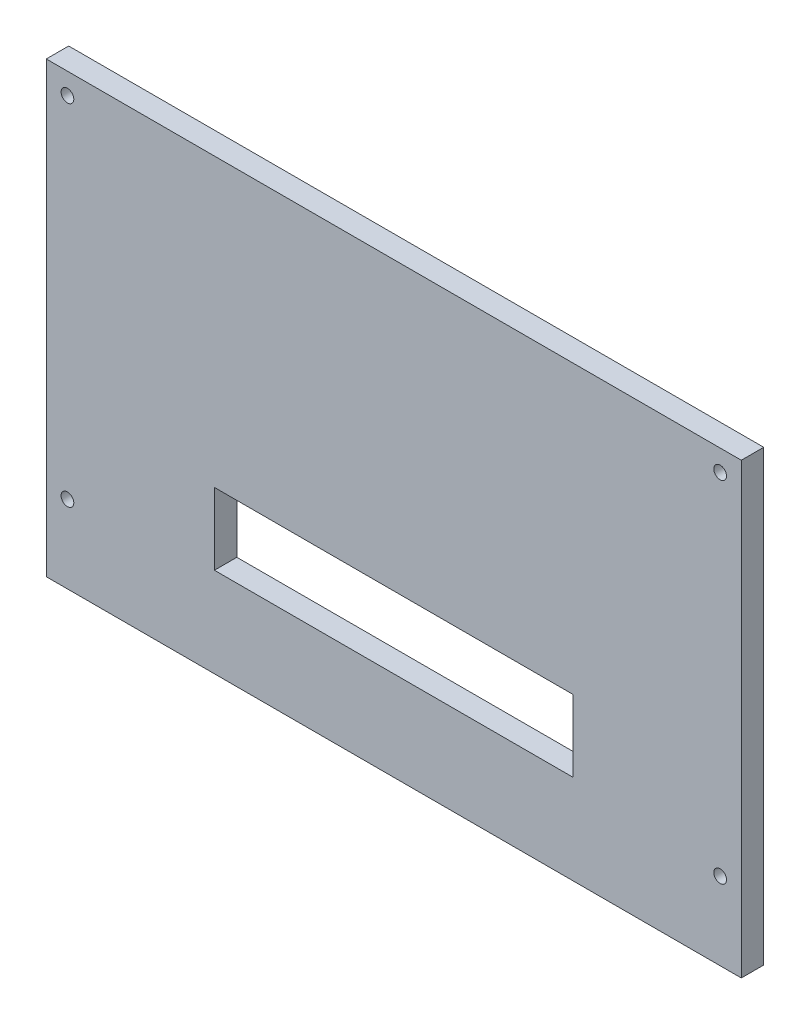
from build123d import *

# Parameters (mm, degrees)
SKETCH1_W            = 196.85
SKETCH1_H            = 127
BOSS_EXTRUDE1_DEPTH  = 6.35
M3_CLEARANCE_HOLE1_D = 3.6
SKETCH7_W            = 101.6
SKETCH7_H            = 20.32
TUBINGSLOT_DEPTH     = 235.348554508


with BuildPart() as part:
    # Sketch1 → Boss-Extrude1 (new body)
    with BuildSketch(Plane.XY):
        with Locations((98.425, 63.5)):
            Rectangle(SKETCH1_W, SKETCH1_H)
    extrude(amount=BOSS_EXTRUDE1_DEPTH)

    # M3 Clearance Hole1 (through all)
    with Locations(Plane.XY.offset(6.35)):
        with Locations((5.9944, 121.0056), (5.9944, 21.9964), (190.8556, 21.9964), (190.8556, 121.0056)):
            Hole(M3_CLEARANCE_HOLE1_D / 2)

    # Sketch7 → tubingslot (cut, through all)
    with BuildSketch(Plane.XY.offset(6.35)):
        with Locations((98.425, 35.56)):
            Rectangle(SKETCH7_W, SKETCH7_H)
    extrude(amount=-TUBINGSLOT_DEPTH, mode=Mode.SUBTRACT)


solid = part.part
